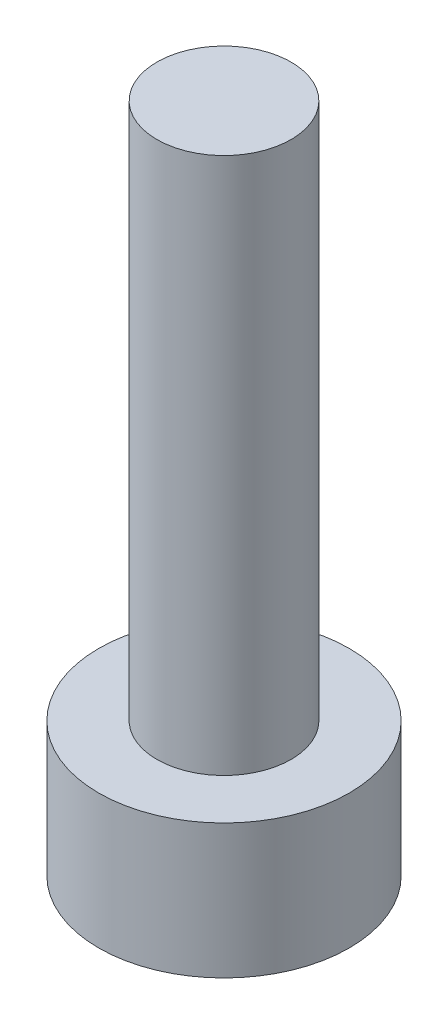
from build123d import *

# Parameters (mm, degrees)
SKETCH_1_R          = 2.8
EXTRUDE_1_DEPTH     = 3
SKETCH_2_R          = 1.5
EXTRUDE_2_DEPTH     = 12
CUT_EXTRUDE_1_DEPTH = 1.5


with BuildPart() as part:
    # 草图1 → 凸台-拉伸1 (new body)
    with BuildSketch(Plane(origin=(0, 0, 0), x_dir=(1, 0, 0), z_dir=(0, 1, 0))):
        Circle(SKETCH_1_R)
    extrude(amount=EXTRUDE_1_DEPTH)

    # 草图2 → 凸台-拉伸2 (add)
    with BuildSketch(Plane(origin=(0, 3, 0), x_dir=(1, 0, 0), z_dir=(0, 1, 0))):
        Circle(SKETCH_2_R)
    extrude(amount=EXTRUDE_2_DEPTH)

    # 草图3 → 切除-拉伸1 (cut)
    with BuildSketch(Plane.XZ):
        Polygon((1.084583442, -0.952371824), (1.367069914, 0.463090901), (0.282486472, 1.415462725), (-1.084583442, 0.952371824), (-1.367069914, -0.463090901), (-0.282486472, -1.415462725), align=None)
    extrude(amount=-CUT_EXTRUDE_1_DEPTH, mode=Mode.SUBTRACT)


solid = part.part
